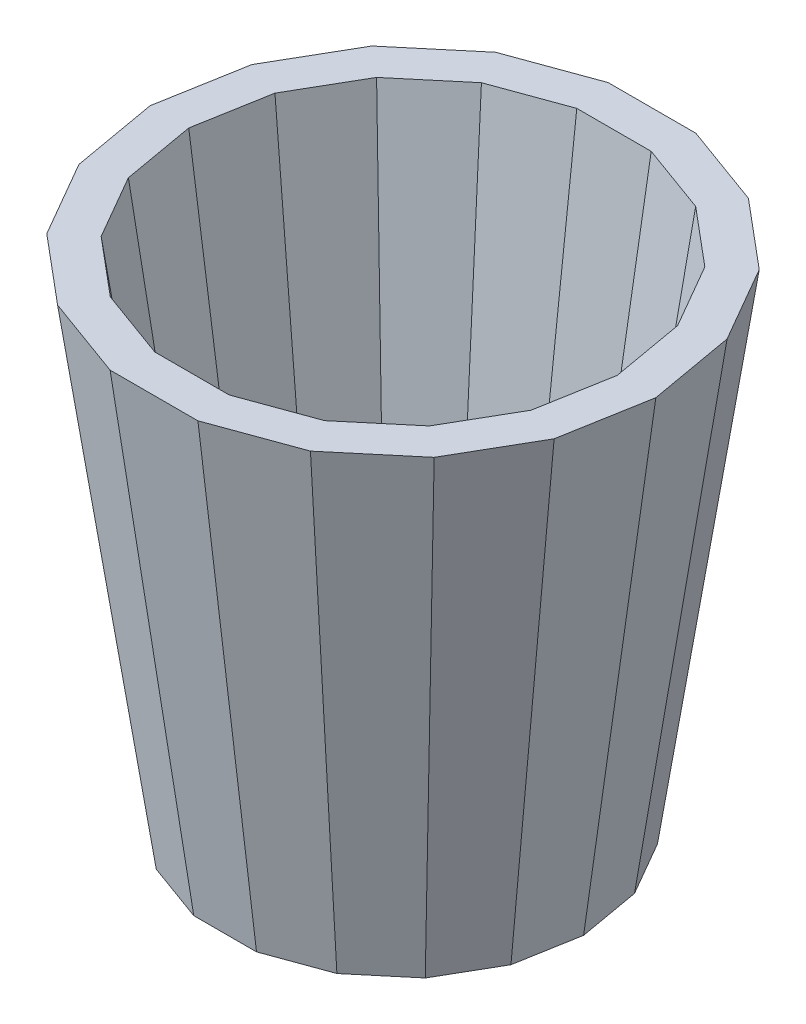
from build123d import *

# Parameters (mm, degrees)
LOFT1_DEPTH = 254
LOFT1_DRAFT = -8.0697267
SHELL1_T    = -19.05


# Read off the part's stored shape, not the designer's step: Loft1
with BuildPart() as part:
    # Loft1 outline → Loft1 (with draft: the straight prism first)
    with BuildSketch(Plane(origin=(0, -254, 0), x_dir=(1, 0, 0), z_dir=(0, 1, 0))):
        Polygon((45.71024071, -79.172459336), (70.032151779, -58.763952728), (85.907151779, -31.267646158), (91.42048142, 0), (85.907151779, 31.267646158), (70.032151779, 58.763952728), (45.71024071, 79.172459336), (15.875, 90.031598886), (-15.875, 90.031598886), (-45.71024071, 79.172459336), (-70.032151779, 58.763952728), (-85.907151779, 31.267646158), (-91.42048142, 0), (-85.907151779, -31.267646158), (-70.032151779, -58.763952728), (-45.71024071, -79.172459336), (-15.875, -90.031598886), (15.875, -90.031598886), align=None)
    extrude(amount=LOFT1_DEPTH)
    # Loft1: the draft: its side faces are tilted about the plane it starts from
    loft1_sides = [part.faces().sort_by_distance(p)[0] for p in [
        (57.871196245, -127, 68.968206032),
        (77.969651779, -127, 45.015799443),
        (88.6638166, -127, 15.633823079),
        (88.663816599, -127, -15.633823079),
        (77.969651779, -127, -45.015799443),
        (57.871196244, -127, -68.968206032),
        (30.792620355, -127, -84.602029111),
        (0, -127, -90.031598886),
        (-30.792620355, -127, -84.602029111),
        (-57.871196245, -127, -68.968206032),
        (-77.969651779, -127, -45.015799443),
        (-88.6638166, -127, -15.633823079),
        (-88.663816599, -127, 15.633823079),
        (-77.969651779, -127, 45.015799443),
        (-57.871196244, -127, 68.968206032),
        (-30.792620355, -127, 84.602029111),
        (0, -127, 90.031598886),
        (30.792620355, -127, 84.602029111),
    ]]
    draft(loft1_sides, Plane(origin=(0, -254, 0), x_dir=(1, 0, 0), z_dir=(0, 1, 0)), LOFT1_DRAFT)

    # Shell1
    shell1_openings = [part.faces().sort_by_distance(p)[0] for p in [
        (0, 0, 0),
        (0, -254, 0),
    ]]
    offset(amount=SHELL1_T, openings=shell1_openings, kind=Kind.INTERSECTION)


solid = part.part
